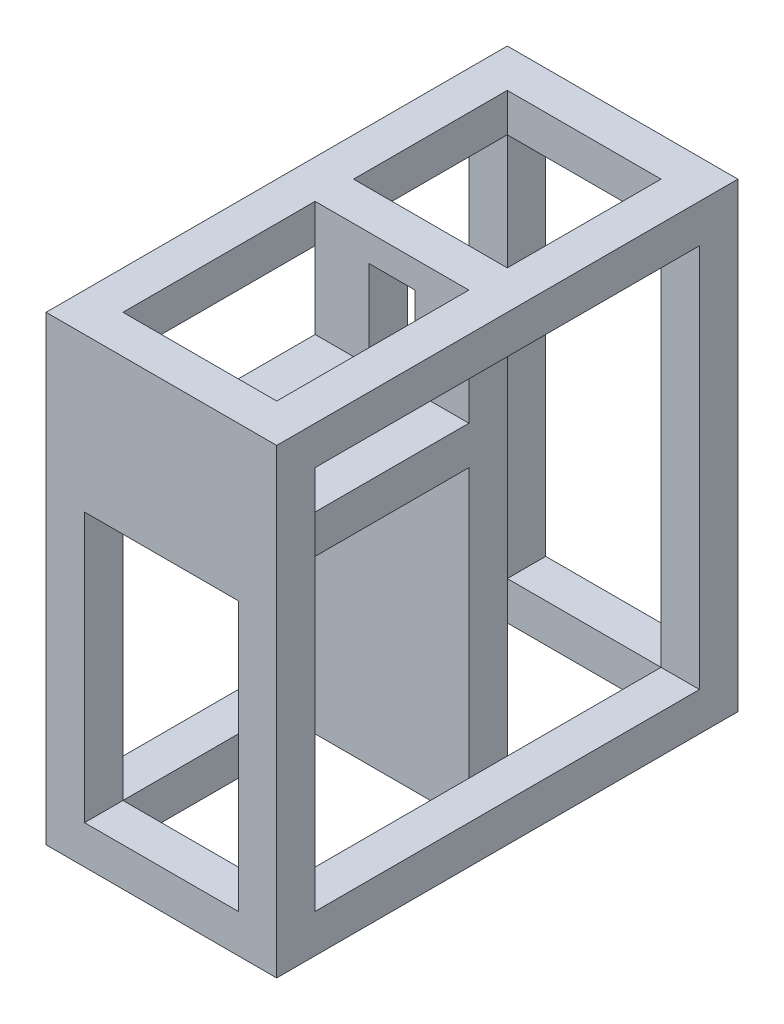
from build123d import *

# Parameters (mm, degrees)
SKETCH1_W               = 152.4
SKETCH1_H               = 304.8
SKETCH1_W_2             = 101.6
SKETCH1_H_2             = 254
BOSS_EXTRUDE1_DEPTH     = 304.8
SKETCH2_W               = 101.6
SKETCH2_H               = 254
CUT_EXTRUDE1_DEPTH      = 304.8
SKETCH5_W               = 254
SKETCH5_H               = 254
CUT_EXTRUDE2_DEPTH      = 374.3022368
BOSS_EXTRUDE2_START     = -304.8
BOSS_EXTRUDE2_OUTLINE_W = 101.6
BOSS_EXTRUDE2_OUTLINE_H = 25.4
BOSS_EXTRUDE2_DEPTH     = 304.8
SKETCH6_W               = 101.6
SKETCH6_H               = 25.4
BOSS_EXTRUDE3_DEPTH     = 152.4
SKETCH7_W               = 30.48
SKETCH7_H               = 58.42
CUT_EXTRUDE3_DEPTH      = 25.654
SKETCH8_W               = 101.6
SKETCH8_H               = 50.8
BOSS_EXTRUDE4_DEPTH     = 25.4


# Read off the part's stored shape, not the designer's step: Boss-Extrude2
with BuildPart() as part:
    # Sketch1 → Boss-Extrude1 (new body)
    with BuildSketch(Plane(origin=(0, 0, 0), x_dir=(1, 0, 0), z_dir=(0, 1, 0))):
        Rectangle(SKETCH1_W, SKETCH1_H)
        Rectangle(SKETCH1_W_2, SKETCH1_H_2, mode=Mode.SUBTRACT)
    extrude(amount=BOSS_EXTRUDE1_DEPTH)

    # Sketch2 → Cut-Extrude1 (cut)
    with BuildSketch(Plane.XY.offset(152.4)):
        with Locations((0, 152.4)):
            Rectangle(SKETCH2_W, SKETCH2_H)
    extrude(amount=-CUT_EXTRUDE1_DEPTH, mode=Mode.SUBTRACT)

    # Sketch5 → Cut-Extrude2 (cut, through all)
    with BuildSketch(Plane(origin=(76.2, 0, 0), x_dir=(0, 0, -1), z_dir=(1, 0, 0))):
        with Locations((0, 152.4)):
            Rectangle(SKETCH5_W, SKETCH5_H)
    extrude(amount=-CUT_EXTRUDE2_DEPTH, mode=Mode.SUBTRACT)

    # Boss-Extrude2 outline → Boss-Extrude2 (add)
    with BuildSketch(Plane.XZ.offset(BOSS_EXTRUDE2_START)):
        with Locations((0, -12.7)):
            Rectangle(BOSS_EXTRUDE2_OUTLINE_W, BOSS_EXTRUDE2_OUTLINE_H)
    extrude(amount=BOSS_EXTRUDE2_DEPTH)

    # Sketch6 → Boss-Extrude3 (add)
    with BuildSketch(Plane.XY):
        with Locations((0, 215.9)):
            Rectangle(SKETCH6_W, SKETCH6_H)
    extrude(amount=BOSS_EXTRUDE3_DEPTH)

    # Sketch7 → Cut-Extrude3 (cut)
    with BuildSketch(Plane.XY):
        with Locations((0, 257.81)):
            Rectangle(SKETCH7_W, SKETCH7_H)
    extrude(amount=-CUT_EXTRUDE3_DEPTH, mode=Mode.SUBTRACT)

    # Sketch8 → Boss-Extrude4 (add)
    with BuildSketch(Plane.XY.offset(152.4)):
        with Locations((0, 254)):
            Rectangle(SKETCH8_W, SKETCH8_H)
    extrude(amount=-BOSS_EXTRUDE4_DEPTH)


solid = part.part
